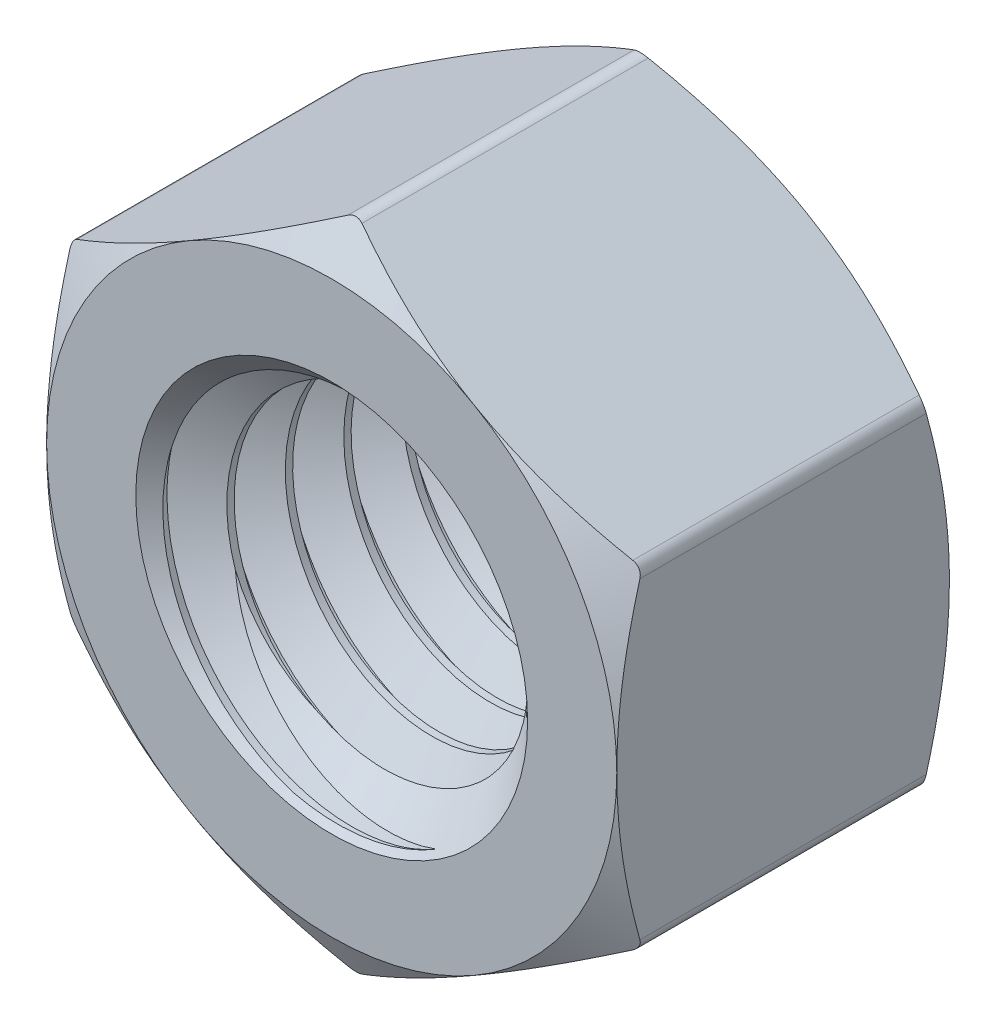
from build123d import *

# Parameters (mm, degrees)
BOSS_EXTRUDE2_DEPTH     = 5.55625
CUT_EXTRUDE4_DEPTH      = 16.574499641
CUT_EXTRUDE4_DEPTH_BACK = 16.574499641
SKETCH16_R              = 6.35
SKETCH7_OUTSIDE_W       = 94.164
SKETCH7_OUTSIDE_H       = 97.112
SKETCH7_OUTSIDE_R       = 9.525
CUT_EXTRUDE5_DEPTH      = 19.307943119
CUT_EXTRUDE5_DRAFT      = -60
MIRROR4_COPY_1_SKETCH_W = 94.164
MIRROR4_COPY_1_SKETCH_H = 97.112
MIRROR4_COPY_1_SKETCH_R = 9.525
MIRROR4_COPY_1_DEPTH    = 19.307943119
MIRROR4_COPY_1_DRAFT    = -60
FILLET2_R               = 0.47625
SKETCH13_R              = 6.35
BOSS_EXTRUDE1_DEPTH     = 11.1125
CUT_SWEEP1_PITCH        = 1.953846154
SKETCH17_R              = 6.35
BOSS_EXTRUDE3_DEPTH     = 11.1125


with BuildPart() as part:
    # Sketch15 → Boss-Extrude2 (new, symmetric)
    with BuildSketch(Plane.XY):
        Polygon((0, 10.998522628), (-9.525, 5.499261314), (-9.525, -5.499261314), (0, -10.998522628), (9.525, -5.499261314), (9.525, 5.499261314), align=None)
    extrude(amount=BOSS_EXTRUDE2_DEPTH, both=True)

    # Sketch16 → Cut-Extrude4 (cut, two sides: drawn at the far end of the back side and taken through both)
    with BuildSketch(Plane.XY.offset(-CUT_EXTRUDE4_DEPTH_BACK)):
        Circle(SKETCH16_R)
    extrude(amount=CUT_EXTRUDE4_DEPTH + CUT_EXTRUDE4_DEPTH_BACK, mode=Mode.SUBTRACT)


with BuildPart() as cut_extrude5_tool:
    # Sketch7 outside → Cut-Extrude5 (with draft: the straight prism first)
    with BuildSketch(Plane.XY.offset(5.55625)):
        Rectangle(SKETCH7_OUTSIDE_W, SKETCH7_OUTSIDE_H)
        Circle(SKETCH7_OUTSIDE_R, mode=Mode.SUBTRACT)
    extrude(amount=-CUT_EXTRUDE5_DEPTH)
    # Cut-Extrude5: the draft: its side faces are tilted about the plane it starts from
    cut_extrude5_sides = [cut_extrude5_tool.faces().sort_by_distance(p)[0] for p in [
        (0, -48.556, -4.09772156),
        (47.082, 0, -4.09772156),
        (0, 48.556, -4.09772156),
        (-47.082, 0, -4.09772156),
        (-9.525, 0, -4.09772156),
    ]]
    draft(cut_extrude5_sides, Plane.XY.offset(5.55625), CUT_EXTRUDE5_DRAFT)


with BuildPart() as part_1:
    add(part.part)

    # Cut-Extrude5: cut by cut_extrude5_tool
    add(cut_extrude5_tool.part, mode=Mode.SUBTRACT)


with BuildPart() as mirror4_copy_1_tool:
    # Mirror4 copy 1 sketch → Mirror4 copy 1 (with draft: the straight prism first)
    with BuildSketch(Plane(origin=(0, 0, -5.55625), x_dir=(1, 0, 0), z_dir=(0, 0, -1))):
        Rectangle(MIRROR4_COPY_1_SKETCH_W, MIRROR4_COPY_1_SKETCH_H)
        Circle(MIRROR4_COPY_1_SKETCH_R, mode=Mode.SUBTRACT)
    extrude(amount=-MIRROR4_COPY_1_DEPTH)
    # Mirror4 copy 1: the draft: its side faces are tilted about the plane it starts from
    mirror4_copy_1_sides = [mirror4_copy_1_tool.faces().sort_by_distance(p)[0] for p in [
        (0, -48.556, 4.09772156),
        (47.082, 0, 4.09772156),
        (0, 48.556, 4.09772156),
        (-47.082, 0, 4.09772156),
        (-9.525, 0, 4.09772156),
    ]]
    draft(mirror4_copy_1_sides, Plane(origin=(0, 0, -5.55625), x_dir=(1, 0, 0), z_dir=(0, 0, -1)), MIRROR4_COPY_1_DRAFT)


with BuildPart() as part_2:
    add(part_1.part)

    # Mirror4 copy 1: cut by mirror4_copy_1_tool
    add(mirror4_copy_1_tool.part, mode=Mode.SUBTRACT)

    # Fillet2
    fillet2_edges = [part_2.edges().sort_by_distance(p)[0] for p in [
        (-9.525, 5.499261314, 0),
        (-9.525, -5.499261314, 0),
        (0, -10.998522628, 0),
        (9.525, -5.499261314, 0),
        (9.525, 5.499261314, 0),
        (0, 10.998522628, 0),
    ]]
    fillet(fillet2_edges, radius=FILLET2_R)

    # Sketch17 → Boss-Extrude3 (add)
    with BuildSketch(Plane.XY.offset(5.55625)):
        Circle(SKETCH17_R)
    extrude(amount=-BOSS_EXTRUDE3_DEPTH)


with BuildPart() as body_2:
    # Sketch13 → Boss-Extrude1 (new body)
    with BuildSketch(Plane(origin=(0, 0, -5.55625), x_dir=(-1, 0, 0), z_dir=(0, 0, -1))):
        Circle(SKETCH13_R)
    extrude(amount=-BOSS_EXTRUDE1_DEPTH)

    # Cut-Sweep1: the profile of Sketch12 profile screwed along a right-hand helix of 6.6875 turns, 10 arcs to a turn; built about Z, then put on its axis
    cut_sweep1_z = Axis((0, 0, 0), (0, 0, 1))
    cut_sweep1_corners = [(6.3503, 0, -1.70978859), (6.3503, 0, 0.000173205), (5.080939697, 0, -0.732692308), (5.080939697, 0, -0.976923077)]
    with BuildLine(mode=Mode.PRIVATE) as cut_sweep1_profile:
        Line(cut_sweep1_corners[0], cut_sweep1_corners[1])
        Line(cut_sweep1_corners[1], cut_sweep1_corners[2])
        Line(cut_sweep1_corners[2], cut_sweep1_corners[3])
        Line(cut_sweep1_corners[3], cut_sweep1_corners[0])
    cut_sweep1_cap = Face(cut_sweep1_profile.wire())
    cut_sweep1_turn_angles = [0, 18, 36, 54, 72, 90, 108, 126, 144, 162, 180, 198, 216, 234, 252, 270, 288, 306, 324, 342, 360]
    cut_sweep1_turn_weights = [1, 0.9510565162951535, 1, 0.9510565162951535, 1, 0.9510565162951535, 1, 0.9510565162951535, 1, 0.9510565162951535, 1, 0.9510565162951535, 1, 0.9510565162951535, 1, 0.9510565162951535, 1, 0.9510565162951535, 1, 0.9510565162951535, 1]
    cut_sweep1_turn_rails = [Edge.make_bspline([Vector(p[0], p[1], 0).rotate(cut_sweep1_z, cut_sweep1_turn_angles[k]) / cut_sweep1_turn_weights[k] + Vector(0, 0, p[2] + CUT_SWEEP1_PITCH * cut_sweep1_turn_angles[k] / 360) for k in range(21)], [0, 0, 0, 1, 1, 2, 2, 3, 3, 4, 4, 5, 5, 6, 6, 7, 7, 8, 8, 9, 9, 10, 10, 10], 2, cut_sweep1_turn_weights) for p in cut_sweep1_corners]
    cut_sweep1_turn_sides = [Face.make_surface_from_curves(cut_sweep1_turn_rails[p[0]], cut_sweep1_turn_rails[p[1]]) for p in [(0, 1), (1, 2), (2, 3), (3, 0)]]
    cut_sweep1_last_angles = [2160, 2178, 2196, 2214, 2232, 2250, 2268, 2286, 2304, 2322, 2340, 2358, 2376, 2391.75, 2407.5]
    cut_sweep1_last_weights = [1, 0.9510565162951535, 1, 0.9510565162951535, 1, 0.9510565162951535, 1, 0.9510565162951535, 1, 0.9510565162951535, 1, 0.9510565162951535, 1, 0.9624552364536365, 1]
    cut_sweep1_last_rails = [Edge.make_bspline([Vector(p[0], p[1], 0).rotate(cut_sweep1_z, cut_sweep1_last_angles[k]) / cut_sweep1_last_weights[k] + Vector(0, 0, p[2] + CUT_SWEEP1_PITCH * cut_sweep1_last_angles[k] / 360) for k in range(15)], [0, 0, 0, 1, 1, 2, 2, 3, 3, 4, 4, 5, 5, 6, 6, 7, 7, 7], 2, cut_sweep1_last_weights) for p in cut_sweep1_corners]
    cut_sweep1_last_sides = [Face.make_surface_from_curves(cut_sweep1_last_rails[p[0]], cut_sweep1_last_rails[p[1]]) for p in [(0, 1), (1, 2), (2, 3), (3, 0)]]
    cut_sweep1 = Plane(origin=(0, 0, -5.55625), x_dir=(0, 1, 0), z_dir=(0, 0, 1)) * Solid(Shell([*[p.moved(Location((0, 0, CUT_SWEEP1_PITCH * i))) for i in range(6) for p in cut_sweep1_turn_sides], *cut_sweep1_last_sides, cut_sweep1_cap, cut_sweep1_cap.rotate(cut_sweep1_z, 2407.5).moved(Location((0, 0, CUT_SWEEP1_PITCH * 2407.5 / 360)))]))
    add(cut_sweep1, mode=Mode.SUBTRACT)


with BuildPart() as part_3:
    add(part_2.part)

    # Combine1: cut body 2
    add(body_2.part, mode=Mode.SUBTRACT)

    # Cut-Extrude2 cone 1 section (through the dimple's axis) → Cut-Extrude2 (revolve, cut)
    with BuildSketch(Plane(origin=(0, 0, 5.55625), x_dir=(0, -1, 0), z_dir=(1, 0, 0))):
        Polygon((0, 0), (6.545384615, 0), (0, 6.545384615), align=None)
    revolve(axis=Axis((0, 0, 5.55625), (0, 0, -1)), mode=Mode.SUBTRACT)

    # Cut-Extrude3 cone 1 section (through the dimple's axis) → Cut-Extrude3 (revolve, cut)
    with BuildSketch(Plane(origin=(0, 0, -5.55625), x_dir=(0, 1, 0), z_dir=(1, 0, 0))):
        Polygon((0, 0), (6.545384615, 0), (0, 6.545384615), align=None)
    revolve(axis=Axis((0, 0, -5.55625), (0, 0, 1)), mode=Mode.SUBTRACT)


solid = part_3.part
